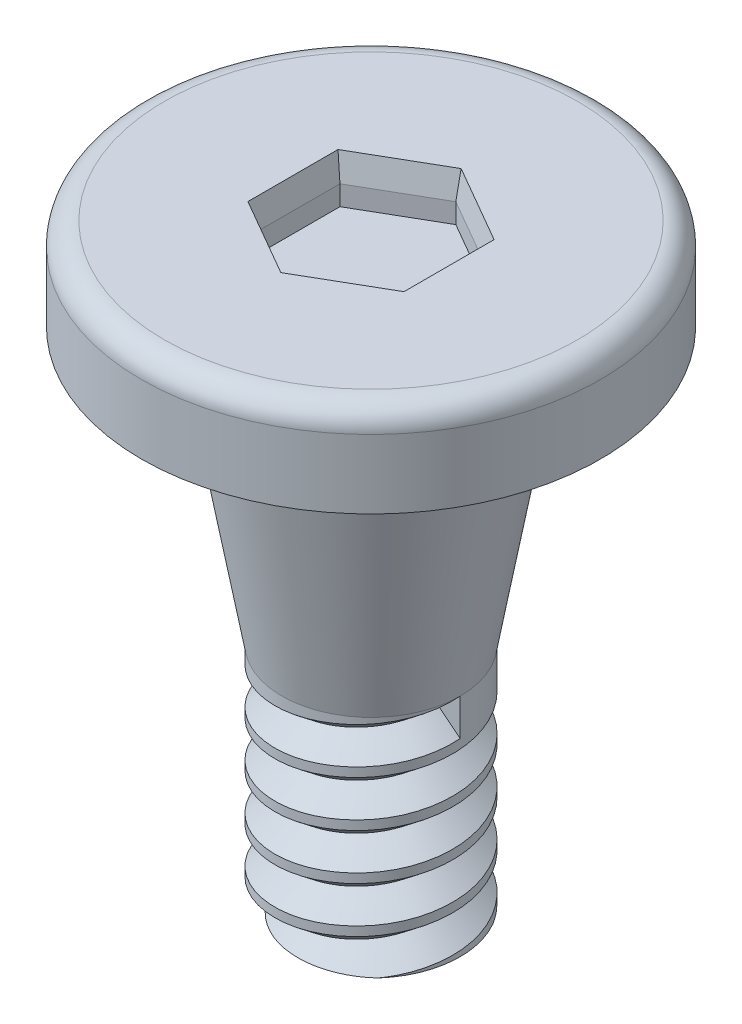
from build123d import *
from build123d.topology import SkipClean

# Parameters (mm, degrees)
ESQUISSE4_W                           = 3.292935648
ESQUISSE4_H                           = 1.153716838
ENL_V_MAT_EXTRU_1_DEPTH               = 1
CHANFREIN1_SIZE                       = 0.1
CHANFREIN1_SIZE2                      = 0.567128182
CONG_1_R                              = 0.5
ENL_VEMENT_DE_MATI_RE_BALAYAGE1_PITCH = 1


with BuildPart() as part:
    # Esquisse1 → Révolution1 (revolve)
    with BuildSketch(Plane.XY, mode=Mode.PRIVATE) as r_volution1_sk:
        Polygon((-3, 0), (-1.942038116, -6), (-1.942038116, -11), (0, -11), (0, 0), (0, 2), (-5, 2), (-5, 0), align=None)
    revolve(r_volution1_sk.sketch.rotate(Axis((0, -11, 0), (0, 1, 0)), 270), axis=Axis((0, -11, 0), (0, 1, 0)))

    # Esquisse4 → Enlèvement de matière-Révolution1 (revolve, cut)
    with BuildSketch(Plane.XY, mode=Mode.PRIVATE) as enl_vement_de_mati_re_r_volution1_sk:
        with Locations((1.646467824, -11.493285508)):
            Rectangle(ESQUISSE4_W, ESQUISSE4_H)
    revolve(enl_vement_de_mati_re_r_volution1_sk.sketch.rotate(Axis((0, -10.860421417, 0), (0, -1, 0)), 270), axis=Axis((0, -10.860421417, 0), (0, -1, 0)), mode=Mode.SUBTRACT)

    # Esquisse5 → Enlèv. mat.-Extru.1 (cut)
    with BuildSketch(Plane(origin=(0, 2, 0), x_dir=(1, 0, 0), z_dir=(0, 1, 0))):
        Polygon((0, 1.847520861), (-1.6, 0.923760431), (-1.6, -0.923760431), (0, -1.847520861), (1.6, -0.923760431), (1.6, 0.923760431), align=None)
    extrude(amount=-ENL_V_MAT_EXTRU_1_DEPTH, mode=Mode.SUBTRACT)

    # Chanfrein1
    chanfrein1_edges = [part.edges().sort_by_distance(p)[0] for p in [
        (0.8, 2, -1.385640646),
        (-0.8, 2, -1.385640646),
        (-1.6, 2, 0),
        (-0.8, 2, 1.385640646),
        (0.8, 2, 1.385640646),
        (1.6, 2, 0),
    ]]
    chanfrein1_side = [part.faces().sort_by_distance(p)[0] for p in [
        (0, 2, 4.858578644),
    ]]
    chamfer(chanfrein1_edges, length=CHANFREIN1_SIZE, length2=CHANFREIN1_SIZE2, reference=chanfrein1_side[0])

    # Congé1
    cong_1_edges = [part.edges().sort_by_distance(p)[0] for p in [
        (0, 2, 5),
    ]]
    fillet(cong_1_edges, radius=CONG_1_R)

    # Enlèvement de matière-Balayage1: the profile of Esquisse3 profile screwed along a right-hand helix of 5 turns, 8 arcs to a turn; built about Z, then put on its axis
    with SkipClean():  # the faces are left unmerged after this step: merging them gives an invalid solid
        enl_vement_de_mati_re_balayage1_z = Axis((0, 0, 0), (0, 0, 1))
        enl_vement_de_mati_re_balayage1_corners = [(1.942338116, 0, -0.00024), (1.942338116, 0, 0.80024), (1.442038116, 0, 0.4)]
        with BuildLine(mode=Mode.PRIVATE) as enl_vement_de_mati_re_balayage1_profile:
            Line(enl_vement_de_mati_re_balayage1_corners[0], enl_vement_de_mati_re_balayage1_corners[1])
            Line(enl_vement_de_mati_re_balayage1_corners[1], enl_vement_de_mati_re_balayage1_corners[2])
            Line(enl_vement_de_mati_re_balayage1_corners[2], enl_vement_de_mati_re_balayage1_corners[0])
        enl_vement_de_mati_re_balayage1_cap = Face(enl_vement_de_mati_re_balayage1_profile.wire())
        enl_vement_de_mati_re_balayage1_turn_angles = [0, 22.5, 45, 67.5, 90, 112.5, 135, 157.5, 180, 202.5, 225, 247.5, 270, 292.5, 315, 337.5, 360]
        enl_vement_de_mati_re_balayage1_turn_weights = [1, 0.9238795325112867, 1, 0.9238795325112867, 1, 0.9238795325112867, 1, 0.9238795325112867, 1, 0.9238795325112867, 1, 0.9238795325112867, 1, 0.9238795325112867, 1, 0.9238795325112867, 1]
        enl_vement_de_mati_re_balayage1_turn_rails = [Edge.make_bspline([Vector(p[0], p[1], 0).rotate(enl_vement_de_mati_re_balayage1_z, enl_vement_de_mati_re_balayage1_turn_angles[k]) / enl_vement_de_mati_re_balayage1_turn_weights[k] + Vector(0, 0, p[2] + ENL_VEMENT_DE_MATI_RE_BALAYAGE1_PITCH * enl_vement_de_mati_re_balayage1_turn_angles[k] / 360) for k in range(17)], [0, 0, 0, 1, 1, 2, 2, 3, 3, 4, 4, 5, 5, 6, 6, 7, 7, 8, 8, 8], 2, enl_vement_de_mati_re_balayage1_turn_weights) for p in enl_vement_de_mati_re_balayage1_corners]
        enl_vement_de_mati_re_balayage1_turn_sides = [Face.make_surface_from_curves(enl_vement_de_mati_re_balayage1_turn_rails[p[0]], enl_vement_de_mati_re_balayage1_turn_rails[p[1]]) for p in [(0, 1), (1, 2), (2, 0)]]
        enl_vement_de_mati_re_balayage1 = Plane(origin=(0, -6, 0), x_dir=(1, 0, 0), z_dir=(0, -1, 0)) * Solid(Shell([*[p.moved(Location((0, 0, ENL_VEMENT_DE_MATI_RE_BALAYAGE1_PITCH * i))) for i in range(5) for p in enl_vement_de_mati_re_balayage1_turn_sides], enl_vement_de_mati_re_balayage1_cap, enl_vement_de_mati_re_balayage1_cap.rotate(enl_vement_de_mati_re_balayage1_z, 1800).moved(Location((0, 0, ENL_VEMENT_DE_MATI_RE_BALAYAGE1_PITCH * 1800 / 360)))]))
        add(enl_vement_de_mati_re_balayage1, mode=Mode.SUBTRACT)


solid = part.part
